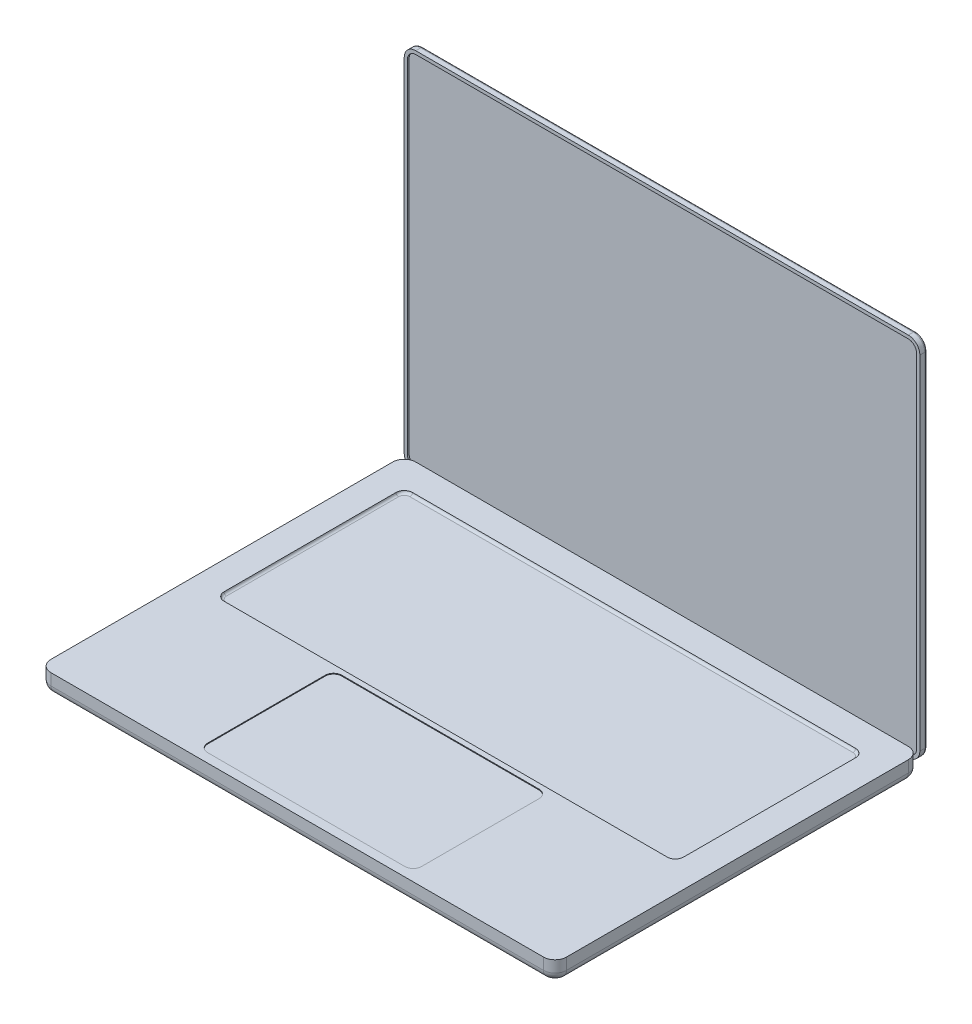
from build123d import *

# Parameters (mm, degrees)
BOSS_EXTRUDE1_DEPTH = 12
BOSS_EXTRUDE2_DEPTH = 4.5
FILLET1_R           = 5
FILLET2_R           = 1.5
CUT_EXTRUDE1_DEPTH  = 1
CUT_EXTRUDE2_DEPTH  = 1.5
CUT_EXTRUDE3_DEPTH  = 0.5
FILLET3_R           = 1.5


with BuildPart() as part:
    # Sketch1 → Boss-Extrude1 (new body)
    with BuildSketch(Plane(origin=(0, 0, 0), x_dir=(1, 0, 0), z_dir=(0, 1, 0))):
        with BuildLine():
            Line((-149.337, -110.617), (149.337, -110.617))
            ThreePointArc((149.337, -110.617), (154.286747468, -108.566747468), (156.337, -103.617))
            Line((156.337, -103.617), (156.337, 103.617))
            ThreePointArc((156.337, 103.617), (154.286747468, 108.566747468), (149.337, 110.617))
            Line((149.337, 110.617), (-149.337, 110.617))
            ThreePointArc((-149.337, 110.617), (-154.286747468, 108.566747468), (-156.337, 103.617))
            Line((-156.337, 103.617), (-156.337, -103.617))
            ThreePointArc((-156.337, -103.617), (-154.286747468, -108.566747468), (-149.337, -110.617))
        make_face()
    extrude(amount=BOSS_EXTRUDE1_DEPTH)

    # Sketch2 → Boss-Extrude2 (add)
    with BuildSketch(Plane(origin=(0, 0, -110.617), x_dir=(-1, 0, 0), z_dir=(0, 0, -1))):
        with BuildLine():
            Line((-149.337, 6), (149.337, 6))
            ThreePointArc((149.337, 6), (154.286747468, 8.050252532), (156.337, 13))
            Line((156.337, 13), (156.337, 221))
            ThreePointArc((156.337, 221), (154.286747468, 225.949747468), (149.337, 228))
            Line((149.337, 228), (-149.337, 228))
            ThreePointArc((-149.337, 228), (-154.286747468, 225.949747468), (-156.337, 221))
            Line((-156.337, 221), (-156.337, 13))
            ThreePointArc((-156.337, 13), (-154.286747468, 8.050252532), (-149.337, 6))
        make_face()
    extrude(amount=BOSS_EXTRUDE2_DEPTH)

    # Fillet1
    fillet1_edges = [part.edges().sort_by_distance(p)[0] for p in [
        (-156.337, 0, 0),
        (-154.286747468, 0, -108.566747468),
        (0, 0, -110.617),
        (154.286747468, 0, -108.566747468),
        (156.337, 0, 0),
        (154.286747468, 0, 108.566747468),
        (0, 0, 110.617),
        (-154.286747468, 0, 108.566747468),
    ]]
    fillet(fillet1_edges, radius=FILLET1_R)

    # Fillet2
    fillet2_edges = [part.edges().sort_by_distance(p)[0] for p in [
        (154.286747468, 8.050252532, -115.117),
        (0, 6, -115.117),
        (-154.286747468, 8.050252532, -115.117),
        (-156.337, 117, -115.117),
        (-154.286747468, 225.949747468, -115.117),
        (0, 228, -115.117),
        (154.286747468, 225.949747468, -115.117),
        (156.337, 117, -115.117),
    ]]
    fillet(fillet2_edges, radius=FILLET2_R)

    # Sketch3 → Cut-Extrude1 (cut)
    with BuildSketch(Plane.XY.offset(-110.617)):
        with BuildLine():
            Line((-151.337, 8.417424305), (151.337, 8.417424305))
            ThreePointArc((151.337, 8.417424305), (153.520300133, 10.261387212), (154.337, 13))
            Line((154.337, 13), (154.337, 221))
            ThreePointArc((154.337, 221), (152.872533906, 224.535533906), (149.337, 226))
            Line((149.337, 226), (-149.337, 226))
            ThreePointArc((-149.337, 226), (-152.872533906, 224.535533906), (-154.337, 221))
            Line((-154.337, 221), (-154.337, 13))
            ThreePointArc((-154.337, 13), (-153.520300133, 10.261387212), (-151.337, 8.417424305))
        make_face()
    extrude(amount=-CUT_EXTRUDE1_DEPTH, mode=Mode.SUBTRACT)

    # Sketch4 → Cut-Extrude2 (cut)
    with BuildSketch(Plane(origin=(0, 12, 0), x_dir=(1, 0, 0), z_dir=(0, 1, 0))):
        with BuildLine():
            Line((-134.337, -20.617), (134.337, -20.617))
            ThreePointArc((134.337, -20.617), (137.872533906, -19.152533906), (139.337, -15.617))
            Line((139.337, -15.617), (139.337, 88.617))
            ThreePointArc((139.337, 88.617), (137.872533906, 92.152533906), (134.337, 93.617))
            Line((134.337, 93.617), (-134.337, 93.617))
            ThreePointArc((-134.337, 93.617), (-137.872533906, 92.152533906), (-139.337, 88.617))
            Line((-139.337, 88.617), (-139.337, -15.617))
            ThreePointArc((-139.337, -15.617), (-137.872533906, -19.152533906), (-134.337, -20.617))
        make_face()
    extrude(amount=-CUT_EXTRUDE2_DEPTH, mode=Mode.SUBTRACT)

    # Sketch4<3> → Cut-Extrude3 (cut)
    with BuildSketch(Plane(origin=(0, 12, 0), x_dir=(1, 0, 0), z_dir=(0, 1, 0))):
        with BuildLine():
            Line((-59.837, -23.767), (59.837, -23.767))
            ThreePointArc((59.837, -23.767), (63.372533906, -25.231466094), (64.837, -28.767))
            Line((64.837, -28.767), (64.837, -100.117))
            ThreePointArc((64.837, -100.117), (63.372533906, -103.652533906), (59.837, -105.117))
            Line((59.837, -105.117), (-59.837, -105.117))
            ThreePointArc((-59.837, -105.117), (-63.372533906, -103.652533906), (-64.837, -100.117))
            Line((-64.837, -100.117), (-64.837, -28.767))
            ThreePointArc((-64.837, -28.767), (-63.372533906, -25.231466094), (-59.837, -23.767))
        make_face()
    extrude(amount=-CUT_EXTRUDE3_DEPTH, mode=Mode.SUBTRACT)

    # Fillet3
    fillet3_edges = [part.edges().sort_by_distance(p)[0] for p in [
        (-137.872533906, 10.5, -92.152533906),
        (-139.337, 10.5, -36.5),
        (-137.872533906, 10.5, 19.152533906),
        (0, 10.5, 20.617),
        (137.872533906, 10.5, 19.152533906),
        (139.337, 10.5, -36.5),
        (137.872533906, 10.5, -92.152533906),
        (0, 10.5, -93.617),
    ]]
    fillet(fillet3_edges, radius=FILLET3_R - 0.0001)  # a hair under: the kernel refuses the full size


solid = part.part
